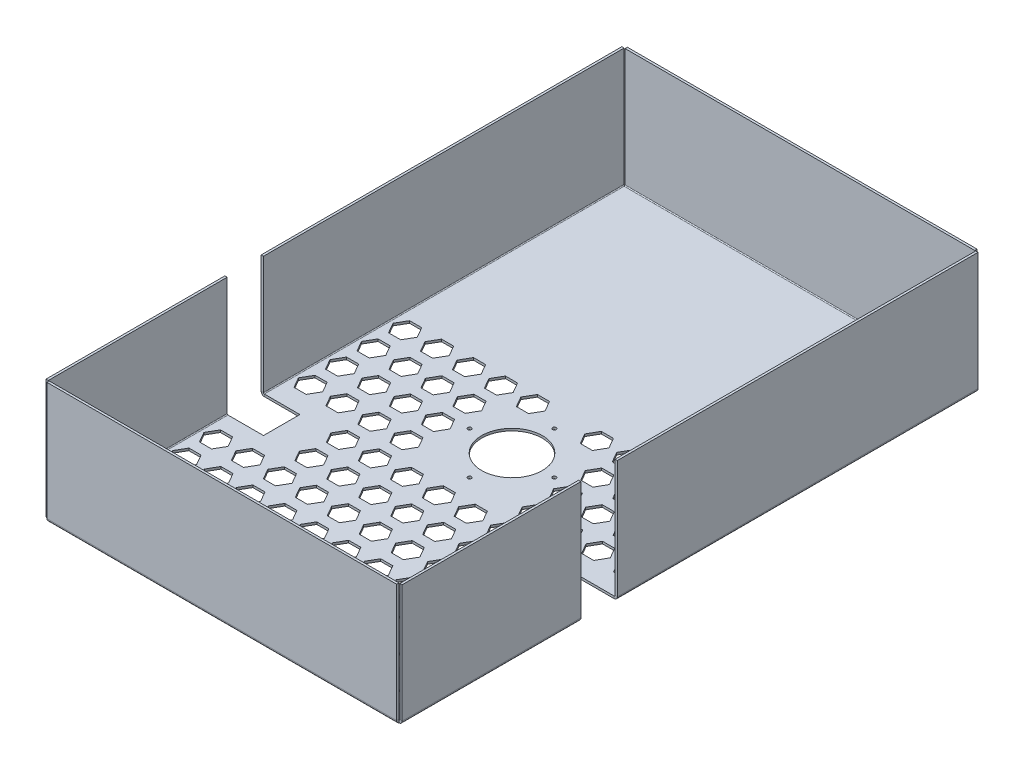
from build123d import *

# Parameters (mm, degrees)
CROQUIS1_R                         = 1.5
BRIDA_BASE2_DEPTH                  = 1.9
CROQUIS3_R                         = 25
CORTAR_EXTRUIR1_DEPTH              = 10
BRIDA_DE_ARISTA1_STRIP_W           = 9.0732
BRIDA_DE_ARISTA1_STRIP_H           = 1.9
BRIDA_DE_ARISTA1_STRIP_CUT_DEPTH   = 297.5
BRIDA_DE_ARISTA1_STRIP_2_W         = 9.0732
BRIDA_DE_ARISTA1_STRIP_2_H         = 1.9
BRIDA_DE_ARISTA1_STRIP_CUT_2_DEPTH = 297.5
BRIDA_DE_ARISTA1_STRIP_3_W         = 9.0732
BRIDA_DE_ARISTA1_STRIP_3_H         = 1.9
BRIDA_DE_ARISTA1_STRIP_CUT_3_DEPTH = 147.5
BRIDA_DE_ARISTA1_STRIP_4_W         = 9.0732
BRIDA_DE_ARISTA1_STRIP_4_H         = 1.9
BRIDA_DE_ARISTA1_STRIP_CUT_4_DEPTH = 147.5
BRIDA_DE_ARISTA1_DEPTH             = 297.5
BRIDA_DE_ARISTA1_BEND_DEPTH        = 297.5
BRIDA_DE_ARISTA1_BEND_2_DEPTH      = 147.5
BRIDA_DE_ARISTA1_BEND_3_DEPTH      = 147.5
BRIDA_DE_ARISTA2_STRIP_W           = 9.0732
BRIDA_DE_ARISTA2_STRIP_H           = 1.9
BRIDA_DE_ARISTA2_STRIP_CUT_DEPTH   = 288.5268
BRIDA_DE_ARISTA2_STRIP_2_W         = 9.0732
BRIDA_DE_ARISTA2_STRIP_2_H         = 1.9
BRIDA_DE_ARISTA2_STRIP_CUT_2_DEPTH = 288.5268
BRIDA_DE_ARISTA2_DEPTH             = 288.5268
BRIDA_DE_ARISTA2_BEND_DEPTH        = 288.5268


# Sheet-metal steps are written as plain solids
with BuildPart() as part:
    # Croquis1 → Brida base2 (new body)
    with BuildSketch(Plane(origin=(0, 0, 0), x_dir=(1, 0, 0), z_dir=(0, 1, 0))):
        Polygon((-145, 237.5), (145, 237.5), (145, -60), (115, -60), (115, -90), (145, -90), (145, -237.5), (-145, -237.5), (-145, -90), (-115, -90), (-115, -60), (-145, -60), align=None)
        with Locations(Location((0, 35, 0), (0, 0, 270))):
            Circle(CROQUIS1_R, mode=Mode.SUBTRACT)
        with Locations(Location((-35, 0, 0), (0, 0, 270))):
            Circle(CROQUIS1_R, mode=Mode.SUBTRACT)
        with Locations(Location((0, -35, 0), (0, 0, 270))):
            Circle(CROQUIS1_R, mode=Mode.SUBTRACT)
        with Locations(Location((35, 0, 0), (0, 0, 270))):
            Circle(CROQUIS1_R, mode=Mode.SUBTRACT)
        Polygon((-121.818181818, 43.66), (-126.818181818, 52.320254038), (-136.818181818, 52.320254038), (-141.818181818, 43.66), (-136.818181818, 34.999745962), (-126.818181818, 34.999745962), align=None, mode=Mode.SUBTRACT)
        Polygon((-95.458181818, 43.66), (-100.458181818, 52.320254038), (-110.458181818, 52.320254038), (-115.458181818, 43.66), (-110.458181818, 34.999745962), (-100.458181818, 34.999745962), align=None, mode=Mode.SUBTRACT)
        Polygon((-69.098181818, 43.66), (-74.098181818, 52.320254038), (-84.098181818, 52.320254038), (-89.098181818, 43.66), (-84.098181818, 34.999745962), (-74.098181818, 34.999745962), align=None, mode=Mode.SUBTRACT)
        Polygon((-42.738181818, 43.66), (-47.738181818, 52.320254038), (-57.738181818, 52.320254038), (-62.738181818, 43.66), (-57.738181818, 34.999745962), (-47.738181818, 34.999745962), align=None, mode=Mode.SUBTRACT)
        Polygon((-16.378181818, 43.66), (-21.378181818, 52.320254038), (-31.378181818, 52.320254038), (-36.378181818, 43.66), (-31.378181818, 34.999745962), (-21.378181818, 34.999745962), align=None, mode=Mode.SUBTRACT)
        Polygon((36.341818182, 43.66), (31.341818182, 52.320254038), (21.341818182, 52.320254038), (16.341818182, 43.66), (21.341818182, 34.999745962), (31.341818182, 34.999745962), align=None, mode=Mode.SUBTRACT)
        Polygon((62.701818182, 43.66), (57.701818182, 52.320254038), (47.701818182, 52.320254038), (42.701818182, 43.66), (47.701818182, 34.999745962), (57.701818182, 34.999745962), align=None, mode=Mode.SUBTRACT)
        Polygon((89.061818182, 43.66), (84.061818182, 52.320254038), (74.061818182, 52.320254038), (69.061818182, 43.66), (74.061818182, 34.999745962), (84.061818182, 34.999745962), align=None, mode=Mode.SUBTRACT)
        Polygon((115.421818182, 43.66), (110.421818182, 52.320254038), (100.421818182, 52.320254038), (95.421818182, 43.66), (100.421818182, 34.999745962), (110.421818182, 34.999745962), align=None, mode=Mode.SUBTRACT)
        Polygon((141.781818182, 43.66), (136.781818182, 52.320254038), (126.781818182, 52.320254038), (121.781818182, 43.66), (126.781818182, 34.999745962), (136.781818182, 34.999745962), align=None, mode=Mode.SUBTRACT)
        Polygon((-121.818181818, 17.66), (-126.818181818, 26.320254038), (-136.818181818, 26.320254038), (-141.818181818, 17.66), (-136.818181818, 8.999745962), (-126.818181818, 8.999745962), align=None, mode=Mode.SUBTRACT)
        Polygon((-95.458181818, 17.66), (-100.458181818, 26.320254038), (-110.458181818, 26.320254038), (-115.458181818, 17.66), (-110.458181818, 8.999745962), (-100.458181818, 8.999745962), align=None, mode=Mode.SUBTRACT)
        Polygon((-69.098181818, 17.66), (-74.098181818, 26.320254038), (-84.098181818, 26.320254038), (-89.098181818, 17.66), (-84.098181818, 8.999745962), (-74.098181818, 8.999745962), align=None, mode=Mode.SUBTRACT)
        Polygon((-42.738181818, 17.66), (-47.738181818, 26.320254038), (-57.738181818, 26.320254038), (-62.738181818, 17.66), (-57.738181818, 8.999745962), (-47.738181818, 8.999745962), align=None, mode=Mode.SUBTRACT)
        Polygon((62.701818182, 17.66), (57.701818182, 26.320254038), (47.701818182, 26.320254038), (42.701818182, 17.66), (47.701818182, 8.999745962), (57.701818182, 8.999745962), align=None, mode=Mode.SUBTRACT)
        Polygon((89.061818182, 17.66), (84.061818182, 26.320254038), (74.061818182, 26.320254038), (69.061818182, 17.66), (74.061818182, 8.999745962), (84.061818182, 8.999745962), align=None, mode=Mode.SUBTRACT)
        Polygon((115.421818182, 17.66), (110.421818182, 26.320254038), (100.421818182, 26.320254038), (95.421818182, 17.66), (100.421818182, 8.999745962), (110.421818182, 8.999745962), align=None, mode=Mode.SUBTRACT)
        Polygon((141.781818182, 17.66), (136.781818182, 26.320254038), (126.781818182, 26.320254038), (121.781818182, 17.66), (126.781818182, 8.999745962), (136.781818182, 8.999745962), align=None, mode=Mode.SUBTRACT)
        Polygon((-121.818181818, -8.34), (-126.818181818, 0.320254038), (-136.818181818, 0.320254038), (-141.818181818, -8.34), (-136.818181818, -17.000254038), (-126.818181818, -17.000254038), align=None, mode=Mode.SUBTRACT)
        Polygon((-95.458181818, -8.34), (-100.458181818, 0.320254038), (-110.458181818, 0.320254038), (-115.458181818, -8.34), (-110.458181818, -17.000254038), (-100.458181818, -17.000254038), align=None, mode=Mode.SUBTRACT)
        Polygon((-69.098181818, -8.34), (-74.098181818, 0.320254038), (-84.098181818, 0.320254038), (-89.098181818, -8.34), (-84.098181818, -17.000254038), (-74.098181818, -17.000254038), align=None, mode=Mode.SUBTRACT)
        Polygon((-42.738181818, -8.34), (-47.738181818, 0.320254038), (-57.738181818, 0.320254038), (-62.738181818, -8.34), (-57.738181818, -17.000254038), (-47.738181818, -17.000254038), align=None, mode=Mode.SUBTRACT)
        Polygon((62.701818182, -8.34), (57.701818182, 0.320254038), (47.701818182, 0.320254038), (42.701818182, -8.34), (47.701818182, -17.000254038), (57.701818182, -17.000254038), align=None, mode=Mode.SUBTRACT)
        Polygon((89.061818182, -8.34), (84.061818182, 0.320254038), (74.061818182, 0.320254038), (69.061818182, -8.34), (74.061818182, -17.000254038), (84.061818182, -17.000254038), align=None, mode=Mode.SUBTRACT)
        Polygon((115.421818182, -8.34), (110.421818182, 0.320254038), (100.421818182, 0.320254038), (95.421818182, -8.34), (100.421818182, -17.000254038), (110.421818182, -17.000254038), align=None, mode=Mode.SUBTRACT)
        Polygon((141.781818182, -8.34), (136.781818182, 0.320254038), (126.781818182, 0.320254038), (121.781818182, -8.34), (126.781818182, -17.000254038), (136.781818182, -17.000254038), align=None, mode=Mode.SUBTRACT)
        Polygon((-121.818181818, -34.34), (-126.818181818, -25.679745962), (-136.818181818, -25.679745962), (-141.818181818, -34.34), (-136.818181818, -43.000254038), (-126.818181818, -43.000254038), align=None, mode=Mode.SUBTRACT)
        Polygon((-95.458181818, -34.34), (-100.458181818, -25.679745962), (-110.458181818, -25.679745962), (-115.458181818, -34.34), (-110.458181818, -43.000254038), (-100.458181818, -43.000254038), align=None, mode=Mode.SUBTRACT)
        Polygon((-69.098181818, -34.34), (-74.098181818, -25.679745962), (-84.098181818, -25.679745962), (-89.098181818, -34.34), (-84.098181818, -43.000254038), (-74.098181818, -43.000254038), align=None, mode=Mode.SUBTRACT)
        Polygon((-42.738181818, -34.34), (-47.738181818, -25.679745962), (-57.738181818, -25.679745962), (-62.738181818, -34.34), (-57.738181818, -43.000254038), (-47.738181818, -43.000254038), align=None, mode=Mode.SUBTRACT)
        Polygon((62.701818182, -34.34), (57.701818182, -25.679745962), (47.701818182, -25.679745962), (42.701818182, -34.34), (47.701818182, -43.000254038), (57.701818182, -43.000254038), align=None, mode=Mode.SUBTRACT)
        Polygon((89.061818182, -34.34), (84.061818182, -25.679745962), (74.061818182, -25.679745962), (69.061818182, -34.34), (74.061818182, -43.000254038), (84.061818182, -43.000254038), align=None, mode=Mode.SUBTRACT)
        Polygon((115.421818182, -34.34), (110.421818182, -25.679745962), (100.421818182, -25.679745962), (95.421818182, -34.34), (100.421818182, -43.000254038), (110.421818182, -43.000254038), align=None, mode=Mode.SUBTRACT)
        Polygon((141.781818182, -34.34), (136.781818182, -25.679745962), (126.781818182, -25.679745962), (121.781818182, -34.34), (126.781818182, -43.000254038), (136.781818182, -43.000254038), align=None, mode=Mode.SUBTRACT)
        Polygon((-69.098181818, -60.34), (-74.098181818, -51.679745962), (-84.098181818, -51.679745962), (-89.098181818, -60.34), (-84.098181818, -69.000254038), (-74.098181818, -69.000254038), align=None, mode=Mode.SUBTRACT)
        Polygon((-42.738181818, -60.34), (-47.738181818, -51.679745962), (-57.738181818, -51.679745962), (-62.738181818, -60.34), (-57.738181818, -69.000254038), (-47.738181818, -69.000254038), align=None, mode=Mode.SUBTRACT)
        Polygon((-16.378181818, -60.34), (-21.378181818, -51.679745962), (-31.378181818, -51.679745962), (-36.378181818, -60.34), (-31.378181818, -69.000254038), (-21.378181818, -69.000254038), align=None, mode=Mode.SUBTRACT)
        Polygon((9.981818182, -60.34), (4.981818182, -51.679745962), (-5.018181818, -51.679745962), (-10.018181818, -60.34), (-5.018181818, -69.000254038), (4.981818182, -69.000254038), align=None, mode=Mode.SUBTRACT)
        Polygon((36.341818182, -60.34), (31.341818182, -51.679745962), (21.341818182, -51.679745962), (16.341818182, -60.34), (21.341818182, -69.000254038), (31.341818182, -69.000254038), align=None, mode=Mode.SUBTRACT)
        Polygon((62.701818182, -60.34), (57.701818182, -51.679745962), (47.701818182, -51.679745962), (42.701818182, -60.34), (47.701818182, -69.000254038), (57.701818182, -69.000254038), align=None, mode=Mode.SUBTRACT)
        Polygon((89.061818182, -60.34), (84.061818182, -51.679745962), (74.061818182, -51.679745962), (69.061818182, -60.34), (74.061818182, -69.000254038), (84.061818182, -69.000254038), align=None, mode=Mode.SUBTRACT)
        Polygon((-69.098181818, -86.34), (-74.098181818, -77.679745962), (-84.098181818, -77.679745962), (-89.098181818, -86.34), (-84.098181818, -95.000254038), (-74.098181818, -95.000254038), align=None, mode=Mode.SUBTRACT)
        Polygon((-42.738181818, -86.34), (-47.738181818, -77.679745962), (-57.738181818, -77.679745962), (-62.738181818, -86.34), (-57.738181818, -95.000254038), (-47.738181818, -95.000254038), align=None, mode=Mode.SUBTRACT)
        Polygon((-16.378181818, -86.34), (-21.378181818, -77.679745962), (-31.378181818, -77.679745962), (-36.378181818, -86.34), (-31.378181818, -95.000254038), (-21.378181818, -95.000254038), align=None, mode=Mode.SUBTRACT)
        Polygon((9.981818182, -86.34), (4.981818182, -77.679745962), (-5.018181818, -77.679745962), (-10.018181818, -86.34), (-5.018181818, -95.000254038), (4.981818182, -95.000254038), align=None, mode=Mode.SUBTRACT)
        Polygon((36.341818182, -86.34), (31.341818182, -77.679745962), (21.341818182, -77.679745962), (16.341818182, -86.34), (21.341818182, -95.000254038), (31.341818182, -95.000254038), align=None, mode=Mode.SUBTRACT)
        Polygon((62.701818182, -86.34), (57.701818182, -77.679745962), (47.701818182, -77.679745962), (42.701818182, -86.34), (47.701818182, -95.000254038), (57.701818182, -95.000254038), align=None, mode=Mode.SUBTRACT)
        Polygon((89.061818182, -86.34), (84.061818182, -77.679745962), (74.061818182, -77.679745962), (69.061818182, -86.34), (74.061818182, -95.000254038), (84.061818182, -95.000254038), align=None, mode=Mode.SUBTRACT)
        Polygon((-121.818181818, -112.34), (-126.818181818, -103.679745962), (-136.818181818, -103.679745962), (-141.818181818, -112.34), (-136.818181818, -121.000254038), (-126.818181818, -121.000254038), align=None, mode=Mode.SUBTRACT)
        Polygon((-95.458181818, -112.34), (-100.458181818, -103.679745962), (-110.458181818, -103.679745962), (-115.458181818, -112.34), (-110.458181818, -121.000254038), (-100.458181818, -121.000254038), align=None, mode=Mode.SUBTRACT)
        Polygon((-69.098181818, -112.34), (-74.098181818, -103.679745962), (-84.098181818, -103.679745962), (-89.098181818, -112.34), (-84.098181818, -121.000254038), (-74.098181818, -121.000254038), align=None, mode=Mode.SUBTRACT)
        Polygon((-42.738181818, -112.34), (-47.738181818, -103.679745962), (-57.738181818, -103.679745962), (-62.738181818, -112.34), (-57.738181818, -121.000254038), (-47.738181818, -121.000254038), align=None, mode=Mode.SUBTRACT)
        Polygon((-16.378181818, -112.34), (-21.378181818, -103.679745962), (-31.378181818, -103.679745962), (-36.378181818, -112.34), (-31.378181818, -121.000254038), (-21.378181818, -121.000254038), align=None, mode=Mode.SUBTRACT)
        Polygon((9.981818182, -112.34), (4.981818182, -103.679745962), (-5.018181818, -103.679745962), (-10.018181818, -112.34), (-5.018181818, -121.000254038), (4.981818182, -121.000254038), align=None, mode=Mode.SUBTRACT)
        Polygon((36.341818182, -112.34), (31.341818182, -103.679745962), (21.341818182, -103.679745962), (16.341818182, -112.34), (21.341818182, -121.000254038), (31.341818182, -121.000254038), align=None, mode=Mode.SUBTRACT)
        Polygon((62.701818182, -112.34), (57.701818182, -103.679745962), (47.701818182, -103.679745962), (42.701818182, -112.34), (47.701818182, -121.000254038), (57.701818182, -121.000254038), align=None, mode=Mode.SUBTRACT)
        Polygon((89.061818182, -112.34), (84.061818182, -103.679745962), (74.061818182, -103.679745962), (69.061818182, -112.34), (74.061818182, -121.000254038), (84.061818182, -121.000254038), align=None, mode=Mode.SUBTRACT)
        Polygon((115.421818182, -112.34), (110.421818182, -103.679745962), (100.421818182, -103.679745962), (95.421818182, -112.34), (100.421818182, -121.000254038), (110.421818182, -121.000254038), align=None, mode=Mode.SUBTRACT)
        Polygon((141.781818182, -112.34), (136.781818182, -103.679745962), (126.781818182, -103.679745962), (121.781818182, -112.34), (126.781818182, -121.000254038), (136.781818182, -121.000254038), align=None, mode=Mode.SUBTRACT)
        Polygon((-121.818181818, -138.34), (-126.818181818, -129.679745962), (-136.818181818, -129.679745962), (-141.818181818, -138.34), (-136.818181818, -147.000254038), (-126.818181818, -147.000254038), align=None, mode=Mode.SUBTRACT)
        Polygon((-95.458181818, -138.34), (-100.458181818, -129.679745962), (-110.458181818, -129.679745962), (-115.458181818, -138.34), (-110.458181818, -147.000254038), (-100.458181818, -147.000254038), align=None, mode=Mode.SUBTRACT)
        Polygon((-69.098181818, -138.34), (-74.098181818, -129.679745962), (-84.098181818, -129.679745962), (-89.098181818, -138.34), (-84.098181818, -147.000254038), (-74.098181818, -147.000254038), align=None, mode=Mode.SUBTRACT)
        Polygon((-42.738181818, -138.34), (-47.738181818, -129.679745962), (-57.738181818, -129.679745962), (-62.738181818, -138.34), (-57.738181818, -147.000254038), (-47.738181818, -147.000254038), align=None, mode=Mode.SUBTRACT)
        Polygon((-16.378181818, -138.34), (-21.378181818, -129.679745962), (-31.378181818, -129.679745962), (-36.378181818, -138.34), (-31.378181818, -147.000254038), (-21.378181818, -147.000254038), align=None, mode=Mode.SUBTRACT)
        Polygon((9.981818182, -138.34), (4.981818182, -129.679745962), (-5.018181818, -129.679745962), (-10.018181818, -138.34), (-5.018181818, -147.000254038), (4.981818182, -147.000254038), align=None, mode=Mode.SUBTRACT)
        Polygon((36.341818182, -138.34), (31.341818182, -129.679745962), (21.341818182, -129.679745962), (16.341818182, -138.34), (21.341818182, -147.000254038), (31.341818182, -147.000254038), align=None, mode=Mode.SUBTRACT)
        Polygon((62.701818182, -138.34), (57.701818182, -129.679745962), (47.701818182, -129.679745962), (42.701818182, -138.34), (47.701818182, -147.000254038), (57.701818182, -147.000254038), align=None, mode=Mode.SUBTRACT)
        Polygon((89.061818182, -138.34), (84.061818182, -129.679745962), (74.061818182, -129.679745962), (69.061818182, -138.34), (74.061818182, -147.000254038), (84.061818182, -147.000254038), align=None, mode=Mode.SUBTRACT)
        Polygon((115.421818182, -138.34), (110.421818182, -129.679745962), (100.421818182, -129.679745962), (95.421818182, -138.34), (100.421818182, -147.000254038), (110.421818182, -147.000254038), align=None, mode=Mode.SUBTRACT)
        Polygon((141.781818182, -138.34), (136.781818182, -129.679745962), (126.781818182, -129.679745962), (121.781818182, -138.34), (126.781818182, -147.000254038), (136.781818182, -147.000254038), align=None, mode=Mode.SUBTRACT)
        Polygon((-121.818181818, -164.34), (-126.818181818, -155.679745962), (-136.818181818, -155.679745962), (-141.818181818, -164.34), (-136.818181818, -173.000254038), (-126.818181818, -173.000254038), align=None, mode=Mode.SUBTRACT)
        Polygon((-95.458181818, -164.34), (-100.458181818, -155.679745962), (-110.458181818, -155.679745962), (-115.458181818, -164.34), (-110.458181818, -173.000254038), (-100.458181818, -173.000254038), align=None, mode=Mode.SUBTRACT)
        Polygon((-69.098181818, -164.34), (-74.098181818, -155.679745962), (-84.098181818, -155.679745962), (-89.098181818, -164.34), (-84.098181818, -173.000254038), (-74.098181818, -173.000254038), align=None, mode=Mode.SUBTRACT)
        Polygon((-42.738181818, -164.34), (-47.738181818, -155.679745962), (-57.738181818, -155.679745962), (-62.738181818, -164.34), (-57.738181818, -173.000254038), (-47.738181818, -173.000254038), align=None, mode=Mode.SUBTRACT)
        Polygon((-16.378181818, -164.34), (-21.378181818, -155.679745962), (-31.378181818, -155.679745962), (-36.378181818, -164.34), (-31.378181818, -173.000254038), (-21.378181818, -173.000254038), align=None, mode=Mode.SUBTRACT)
        Polygon((9.981818182, -164.34), (4.981818182, -155.679745962), (-5.018181818, -155.679745962), (-10.018181818, -164.34), (-5.018181818, -173.000254038), (4.981818182, -173.000254038), align=None, mode=Mode.SUBTRACT)
        Polygon((36.341818182, -164.34), (31.341818182, -155.679745962), (21.341818182, -155.679745962), (16.341818182, -164.34), (21.341818182, -173.000254038), (31.341818182, -173.000254038), align=None, mode=Mode.SUBTRACT)
        Polygon((62.701818182, -164.34), (57.701818182, -155.679745962), (47.701818182, -155.679745962), (42.701818182, -164.34), (47.701818182, -173.000254038), (57.701818182, -173.000254038), align=None, mode=Mode.SUBTRACT)
        Polygon((89.061818182, -164.34), (84.061818182, -155.679745962), (74.061818182, -155.679745962), (69.061818182, -164.34), (74.061818182, -173.000254038), (84.061818182, -173.000254038), align=None, mode=Mode.SUBTRACT)
        Polygon((115.421818182, -164.34), (110.421818182, -155.679745962), (100.421818182, -155.679745962), (95.421818182, -164.34), (100.421818182, -173.000254038), (110.421818182, -173.000254038), align=None, mode=Mode.SUBTRACT)
        Polygon((141.781818182, -164.34), (136.781818182, -155.679745962), (126.781818182, -155.679745962), (121.781818182, -164.34), (126.781818182, -173.000254038), (136.781818182, -173.000254038), align=None, mode=Mode.SUBTRACT)
        Polygon((-121.818181818, -190.34), (-126.818181818, -181.679745962), (-136.818181818, -181.679745962), (-141.818181818, -190.34), (-136.818181818, -199.000254038), (-126.818181818, -199.000254038), align=None, mode=Mode.SUBTRACT)
        Polygon((-95.458181818, -190.34), (-100.458181818, -181.679745962), (-110.458181818, -181.679745962), (-115.458181818, -190.34), (-110.458181818, -199.000254038), (-100.458181818, -199.000254038), align=None, mode=Mode.SUBTRACT)
        Polygon((-69.098181818, -190.34), (-74.098181818, -181.679745962), (-84.098181818, -181.679745962), (-89.098181818, -190.34), (-84.098181818, -199.000254038), (-74.098181818, -199.000254038), align=None, mode=Mode.SUBTRACT)
        Polygon((-42.738181818, -190.34), (-47.738181818, -181.679745962), (-57.738181818, -181.679745962), (-62.738181818, -190.34), (-57.738181818, -199.000254038), (-47.738181818, -199.000254038), align=None, mode=Mode.SUBTRACT)
        Polygon((-16.378181818, -190.34), (-21.378181818, -181.679745962), (-31.378181818, -181.679745962), (-36.378181818, -190.34), (-31.378181818, -199.000254038), (-21.378181818, -199.000254038), align=None, mode=Mode.SUBTRACT)
        Polygon((9.981818182, -190.34), (4.981818182, -181.679745962), (-5.018181818, -181.679745962), (-10.018181818, -190.34), (-5.018181818, -199.000254038), (4.981818182, -199.000254038), align=None, mode=Mode.SUBTRACT)
        Polygon((36.341818182, -190.34), (31.341818182, -181.679745962), (21.341818182, -181.679745962), (16.341818182, -190.34), (21.341818182, -199.000254038), (31.341818182, -199.000254038), align=None, mode=Mode.SUBTRACT)
        Polygon((62.701818182, -190.34), (57.701818182, -181.679745962), (47.701818182, -181.679745962), (42.701818182, -190.34), (47.701818182, -199.000254038), (57.701818182, -199.000254038), align=None, mode=Mode.SUBTRACT)
        Polygon((89.061818182, -190.34), (84.061818182, -181.679745962), (74.061818182, -181.679745962), (69.061818182, -190.34), (74.061818182, -199.000254038), (84.061818182, -199.000254038), align=None, mode=Mode.SUBTRACT)
        Polygon((115.421818182, -190.34), (110.421818182, -181.679745962), (100.421818182, -181.679745962), (95.421818182, -190.34), (100.421818182, -199.000254038), (110.421818182, -199.000254038), align=None, mode=Mode.SUBTRACT)
        Polygon((141.781818182, -190.34), (136.781818182, -181.679745962), (126.781818182, -181.679745962), (121.781818182, -190.34), (126.781818182, -199.000254038), (136.781818182, -199.000254038), align=None, mode=Mode.SUBTRACT)
        Polygon((-121.818181818, -216.34), (-126.818181818, -207.679745962), (-136.818181818, -207.679745962), (-141.818181818, -216.34), (-136.818181818, -225.000254038), (-126.818181818, -225.000254038), align=None, mode=Mode.SUBTRACT)
        Polygon((-95.458181818, -216.34), (-100.458181818, -207.679745962), (-110.458181818, -207.679745962), (-115.458181818, -216.34), (-110.458181818, -225.000254038), (-100.458181818, -225.000254038), align=None, mode=Mode.SUBTRACT)
        Polygon((-69.098181818, -216.34), (-74.098181818, -207.679745962), (-84.098181818, -207.679745962), (-89.098181818, -216.34), (-84.098181818, -225.000254038), (-74.098181818, -225.000254038), align=None, mode=Mode.SUBTRACT)
        Polygon((-42.738181818, -216.34), (-47.738181818, -207.679745962), (-57.738181818, -207.679745962), (-62.738181818, -216.34), (-57.738181818, -225.000254038), (-47.738181818, -225.000254038), align=None, mode=Mode.SUBTRACT)
        Polygon((-16.378181818, -216.34), (-21.378181818, -207.679745962), (-31.378181818, -207.679745962), (-36.378181818, -216.34), (-31.378181818, -225.000254038), (-21.378181818, -225.000254038), align=None, mode=Mode.SUBTRACT)
        Polygon((9.981818182, -216.34), (4.981818182, -207.679745962), (-5.018181818, -207.679745962), (-10.018181818, -216.34), (-5.018181818, -225.000254038), (4.981818182, -225.000254038), align=None, mode=Mode.SUBTRACT)
        Polygon((36.341818182, -216.34), (31.341818182, -207.679745962), (21.341818182, -207.679745962), (16.341818182, -216.34), (21.341818182, -225.000254038), (31.341818182, -225.000254038), align=None, mode=Mode.SUBTRACT)
        Polygon((62.701818182, -216.34), (57.701818182, -207.679745962), (47.701818182, -207.679745962), (42.701818182, -216.34), (47.701818182, -225.000254038), (57.701818182, -225.000254038), align=None, mode=Mode.SUBTRACT)
        Polygon((89.061818182, -216.34), (84.061818182, -207.679745962), (74.061818182, -207.679745962), (69.061818182, -216.34), (74.061818182, -225.000254038), (84.061818182, -225.000254038), align=None, mode=Mode.SUBTRACT)
        Polygon((115.421818182, -216.34), (110.421818182, -207.679745962), (100.421818182, -207.679745962), (95.421818182, -216.34), (100.421818182, -225.000254038), (110.421818182, -225.000254038), align=None, mode=Mode.SUBTRACT)
        Polygon((141.781818182, -216.34), (136.781818182, -207.679745962), (126.781818182, -207.679745962), (121.781818182, -216.34), (126.781818182, -225.000254038), (136.781818182, -225.000254038), align=None, mode=Mode.SUBTRACT)
    extrude(amount=-BRIDA_BASE2_DEPTH)

    # Croquis3 → Cortar-Extruir1 (cut)
    with BuildSketch(Plane(origin=(0, 0, 0), x_dir=(1, 0, 0), z_dir=(0, 1, 0))):
        with Locations(Location((0, 0, 0), (0, 0, 270))):
            Circle(CROQUIS3_R)
    extrude(amount=-CORTAR_EXTRUIR1_DEPTH, mode=Mode.SUBTRACT)

    # Brida de arista1 strip (across the edge) → Brida de arista1 strip cut (cut)
    with BuildSketch(Plane(origin=(145, 0, 60), x_dir=(-1, 0, 0), z_dir=(0, 0, -1))):
        with Locations((-3.8, -0.95)):
            Rectangle(BRIDA_DE_ARISTA1_STRIP_W, BRIDA_DE_ARISTA1_STRIP_H)
    extrude(amount=BRIDA_DE_ARISTA1_STRIP_CUT_DEPTH, mode=Mode.SUBTRACT)

    # Brida de arista1 strip 2 (across the edge) → Brida de arista1 strip cut 2 (cut)
    with BuildSketch(Plane(origin=(-145, 0, -237.5), x_dir=(1, 0, 0), z_dir=(0, 0, 1))):
        with Locations((-3.8, -0.95)):
            Rectangle(BRIDA_DE_ARISTA1_STRIP_2_W, BRIDA_DE_ARISTA1_STRIP_2_H)
    extrude(amount=BRIDA_DE_ARISTA1_STRIP_CUT_2_DEPTH, mode=Mode.SUBTRACT)

    # Brida de arista1 strip 3 (across the edge) → Brida de arista1 strip cut 3 (cut)
    with BuildSketch(Plane(origin=(-145, 0, 90), x_dir=(1, 0, 0), z_dir=(0, 0, 1))):
        with Locations((-3.8, -0.95)):
            Rectangle(BRIDA_DE_ARISTA1_STRIP_3_W, BRIDA_DE_ARISTA1_STRIP_3_H)
    extrude(amount=BRIDA_DE_ARISTA1_STRIP_CUT_3_DEPTH, mode=Mode.SUBTRACT)

    # Brida de arista1 strip 4 (across the edge) → Brida de arista1 strip cut 4 (cut)
    with BuildSketch(Plane(origin=(145, 0, 237.5), x_dir=(-1, 0, 0), z_dir=(0, 0, -1))):
        with Locations((-3.8, -0.95)):
            Rectangle(BRIDA_DE_ARISTA1_STRIP_4_W, BRIDA_DE_ARISTA1_STRIP_4_H)
    extrude(amount=BRIDA_DE_ARISTA1_STRIP_CUT_4_DEPTH, mode=Mode.SUBTRACT)

    # Brida de arista1 section (across the edge) → Brida de arista1 (add)
    with BuildSketch(Plane(origin=(145, 0, 60), x_dir=(-1, 0, 0), z_dir=(0, 0, -1))):
        with BuildLine():
            Line((-1.9, 0.7366), (-1.9, 98.1))
            Line((-1.9, 98.1), (0, 98.1))
            Line((0, 98.1), (0, 0.7366))
            ThreePointArc((0, 0.7366), (0.215745145, 0.215745145), (0.7366, 0))
            Line((0.7366, 0), (0.7366, -1.9))
            ThreePointArc((0.7366, -1.9), (-1.127757739, -1.127757739), (-1.9, 0.7366))
        make_face()
    extrude(amount=BRIDA_DE_ARISTA1_DEPTH)

    # Brida de arista1 section 2 (across the edge) → Brida de arista1 bend (add)
    with BuildSketch(Plane(origin=(-145, 0, -237.5), x_dir=(1, 0, 0), z_dir=(0, 0, 1))):
        with BuildLine():
            Line((-1.9, 0.7366), (-1.9, 98.1))
            Line((-1.9, 98.1), (0, 98.1))
            Line((0, 98.1), (0, 0.7366))
            ThreePointArc((0, 0.7366), (0.215745145, 0.215745145), (0.7366, 0))
            Line((0.7366, 0), (0.7366, -1.9))
            ThreePointArc((0.7366, -1.9), (-1.127757739, -1.127757739), (-1.9, 0.7366))
        make_face()
    extrude(amount=BRIDA_DE_ARISTA1_BEND_DEPTH)

    # Brida de arista1 section 3 (across the edge) → Brida de arista1 bend 2 (add)
    with BuildSketch(Plane(origin=(-145, 0, 90), x_dir=(1, 0, 0), z_dir=(0, 0, 1))):
        with BuildLine():
            Line((-1.9, 0.7366), (-1.9, 98.1))
            Line((-1.9, 98.1), (0, 98.1))
            Line((0, 98.1), (0, 0.7366))
            ThreePointArc((0, 0.7366), (0.215745145, 0.215745145), (0.7366, 0))
            Line((0.7366, 0), (0.7366, -1.9))
            ThreePointArc((0.7366, -1.9), (-1.127757739, -1.127757739), (-1.9, 0.7366))
        make_face()
    extrude(amount=BRIDA_DE_ARISTA1_BEND_2_DEPTH)

    # Brida de arista1 section 4 (across the edge) → Brida de arista1 bend 3 (add)
    with BuildSketch(Plane(origin=(145, 0, 237.5), x_dir=(-1, 0, 0), z_dir=(0, 0, -1))):
        with BuildLine():
            Line((-1.9, 0.7366), (-1.9, 98.1))
            Line((-1.9, 98.1), (0, 98.1))
            Line((0, 98.1), (0, 0.7366))
            ThreePointArc((0, 0.7366), (0.215745145, 0.215745145), (0.7366, 0))
            Line((0.7366, 0), (0.7366, -1.9))
            ThreePointArc((0.7366, -1.9), (-1.127757739, -1.127757739), (-1.9, 0.7366))
        make_face()
    extrude(amount=BRIDA_DE_ARISTA1_BEND_3_DEPTH)

    # Brida de arista2 strip (across the edge) → Brida de arista2 strip cut (cut)
    with BuildSketch(Plane(origin=(144.2634, 0, -237.5), x_dir=(0, 0, 1), z_dir=(-1, 0, 0))):
        with Locations((-3.8, -0.95)):
            Rectangle(BRIDA_DE_ARISTA2_STRIP_W, BRIDA_DE_ARISTA2_STRIP_H)
    extrude(amount=BRIDA_DE_ARISTA2_STRIP_CUT_DEPTH, mode=Mode.SUBTRACT)

    # Brida de arista2 strip 2 (across the edge) → Brida de arista2 strip cut 2 (cut)
    with BuildSketch(Plane(origin=(-144.2634, 0, 237.5), x_dir=(0, 0, -1), z_dir=(1, 0, 0))):
        with Locations((-3.8, -0.95)):
            Rectangle(BRIDA_DE_ARISTA2_STRIP_2_W, BRIDA_DE_ARISTA2_STRIP_2_H)
    extrude(amount=BRIDA_DE_ARISTA2_STRIP_CUT_2_DEPTH, mode=Mode.SUBTRACT)

    # Brida de arista2 section (across the edge) → Brida de arista2 (add)
    with BuildSketch(Plane(origin=(144.2634, 0, -237.5), x_dir=(0, 0, 1), z_dir=(-1, 0, 0))):
        with BuildLine():
            Line((-1.9, 0.7366), (-1.9, 98.1))
            Line((-1.9, 98.1), (0, 98.1))
            Line((0, 98.1), (0, 0.7366))
            ThreePointArc((0, 0.7366), (0.215745145, 0.215745145), (0.7366, 0))
            Line((0.7366, 0), (0.7366, -1.9))
            ThreePointArc((0.7366, -1.9), (-1.127757739, -1.127757739), (-1.9, 0.7366))
        make_face()
    extrude(amount=BRIDA_DE_ARISTA2_DEPTH)

    # Brida de arista2 section 2 (across the edge) → Brida de arista2 bend (add)
    with BuildSketch(Plane(origin=(-144.2634, 0, 237.5), x_dir=(0, 0, -1), z_dir=(1, 0, 0))):
        with BuildLine():
            Line((-1.9, 0.7366), (-1.9, 98.1))
            Line((-1.9, 98.1), (0, 98.1))
            Line((0, 98.1), (0, 0.7366))
            ThreePointArc((0, 0.7366), (0.215745145, 0.215745145), (0.7366, 0))
            Line((0.7366, 0), (0.7366, -1.9))
            ThreePointArc((0.7366, -1.9), (-1.127757739, -1.127757739), (-1.9, 0.7366))
        make_face()
    extrude(amount=BRIDA_DE_ARISTA2_BEND_DEPTH)


solid = part.part
